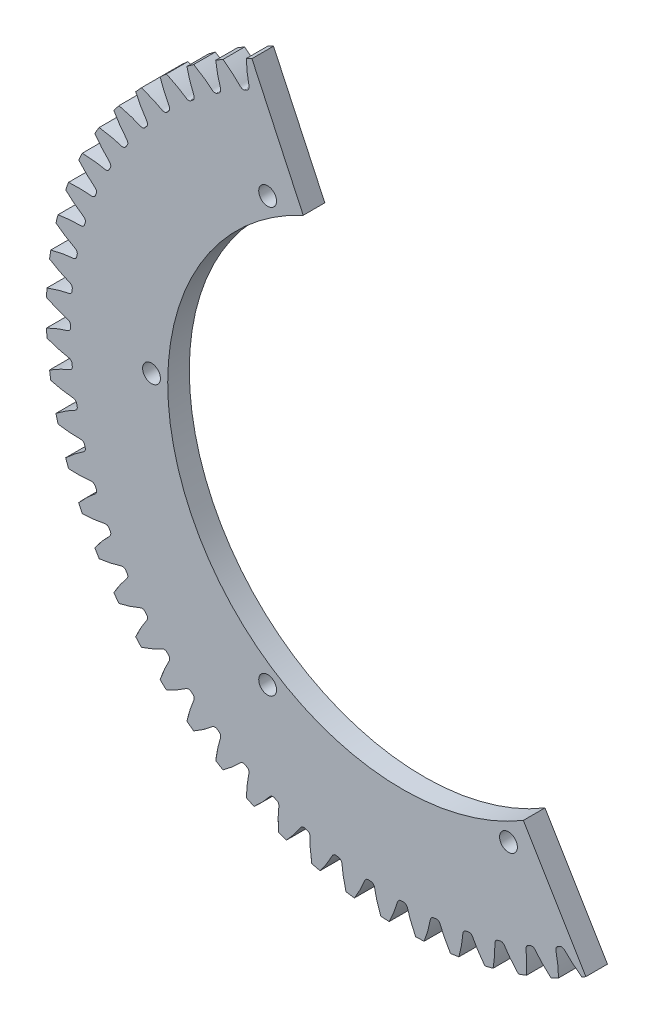
from build123d import *

# Parameters (mm, degrees)
SKETCH_347_W               = 4
SKETCH_347_H               = 65.999999009
CUT_EXTRUDE_657_DEPTH      = 10
PATTERN_CIRCULAR_711_COUNT = 64
SKETCH_746_W               = 20
SKETCH_746_H               = 5
CUT_EXTRUDE_START          = -10
SKETCH_1_R                 = 1.65
CUT_EXTRUDE_1_DEPTH        = 10
CUT_EXTRUDE_START_2        = -8
CUT_EXTRUDE_2_DEPTH        = 8


with BuildPart() as part:
    # Sketch 347 → Revolve 416 (revolve)
    with BuildSketch(Plane(origin=(0, 0, 0), x_dir=(0, 0, -1), z_dir=(1, 0, 0))):
        with Locations((0, 32.999999505)):
            Rectangle(SKETCH_347_W, SKETCH_347_H)
    revolve(axis=Axis((0, 0, 0), (0, 0, -1)))

    # Sketch 461 → Cut-Extrude 657 (cut, symmetric)
    with BuildSketch(Plane.XY):
        with BuildLine():
            ThreePointArc((66.052728022, 2.499397861), (66.099999007, 0), (66.052728022, -2.499397861))
            add(Edge.make_bspline(
                [(66.052728022, -2.499397861), (66.010347767, -2.478097682), (65.946877607, -2.446403725), (65.862330358, -2.404598611), (65.79938941, -2.373681), (65.736735868, -2.343107198), (65.674371094, -2.312875493), (65.612296444, -2.282984169), (65.550513268, -2.253431505), (65.489022907, -2.224215775), (65.427826696, -2.195335251), (65.366925964, -2.166788196), (65.30632203, -2.138572872), (65.24601621, -2.110687535), (65.18600981, -2.083130435), (65.126304128, -2.055899819), (65.066900459, -2.028993931), (65.007800088, -2.002411007), (64.949004292, -1.976149281), (64.890514342, -1.950206981), (64.832331504, -1.924582333), (64.774457033, -1.899273555), (64.716892179, -1.874278864), (64.659638184, -1.84959647), (64.602696283, -1.825224581), (64.546067705, -1.801161399), (64.48975367, -1.777405122), (64.433755392, -1.753953944), (64.378074075, -1.730806056), (64.32271092, -1.707959641), (64.267667117, -1.685412883), (64.212943851, -1.663163957), (64.158542298, -1.641211038), (64.104463628, -1.619552294), (64.050709003, -1.598185889), (63.997279578, -1.577109986), (63.9441765, -1.556322739), (63.891400908, -1.535822304), (63.838953935, -1.515606827), (63.786836707, -1.495674454), (63.73505034, -1.476023327), (63.683595945, -1.456651581), (63.632474625, -1.43755735), (63.581687475, -1.418738764), (63.531235582, -1.400193948), (63.481120026, -1.381921024), (63.431341881, -1.363918109), (63.381902211, -1.346183319), (63.332802074, -1.328714762), (63.28404252, -1.311510547), (63.235624591, -1.294568776), (63.187549322, -1.277887549), (63.139817741, -1.261464962), (63.092430866, -1.245299107), (63.045389711, -1.229388073), (62.99869528, -1.213729945), (62.952348568, -1.198322805), (62.906350566, -1.183164731), (62.860702255, -1.168253798), (62.815404608, -1.153588078), (62.770458593, -1.139165638), (62.725865166, -1.124984543), (62.681625279, -1.111042854), (62.637739875, -1.09733863), (62.594209889, -1.083869926), (62.551036249, -1.070634791), (62.508219873, -1.057631278), (62.465761679, -1.044857421), (62.423662549, -1.032311297), (62.38192346, -1.019990817), (62.340545006, -1.007894487), (62.299529154, -0.996018608), (62.258872779, -0.984367582), (62.180649296, -0.962129409), (62.101810433, -0.940631475), (62.024538042, -0.912404547), (61.983794451, -0.895986993), (61.942672111, -0.877551149), (61.900813329, -0.856593734), (61.857831458, -0.832391826), (61.813334944, -0.803962685), (61.767003704, -0.769967036), (61.718741639, -0.728625092), (61.668955069, -0.677683834), (61.619005679, -0.614565171), (61.571716432, -0.53689732), (61.531861378, -0.443646541), (61.505673668, -0.339741257), (61.495560192, -0.189857501), (61.503034321, 0), (61.495560192, 0.189857501), (61.505673668, 0.339741257), (61.531861378, 0.443646541), (61.571716432, 0.53689732), (61.619005679, 0.614565171), (61.668955069, 0.677683834), (61.718741639, 0.728625092), (61.767003704, 0.769967036), (61.813334944, 0.803962685), (61.857831458, 0.832391826), (61.900813329, 0.856593734), (61.942672111, 0.877551149), (61.983794451, 0.895986993), (62.024538042, 0.912404547), (62.101810433, 0.940631475), (62.180649296, 0.962129409), (62.258872779, 0.984367582), (62.299529154, 0.996018608), (62.340545006, 1.007894487), (62.38192346, 1.019990817), (62.423662549, 1.032311297), (62.465761679, 1.044857421), (62.508219873, 1.057631278), (62.551036249, 1.070634791), (62.594209889, 1.083869926), (62.637739875, 1.09733863), (62.681625279, 1.111042854), (62.725865166, 1.124984543), (62.770458593, 1.139165638), (62.815404608, 1.153588078), (62.860702255, 1.168253798), (62.906350566, 1.183164731), (62.952348568, 1.198322805), (62.99869528, 1.213729945), (63.045389711, 1.229388073), (63.092430866, 1.245299107), (63.139817741, 1.261464962), (63.187549322, 1.277887549), (63.235624591, 1.294568776), (63.28404252, 1.311510547), (63.332802074, 1.328714762), (63.381902211, 1.346183319), (63.431341881, 1.363918109), (63.481120026, 1.381921024), (63.531235582, 1.400193948), (63.581687475, 1.418738764), (63.632474625, 1.43755735), (63.683595945, 1.456651581), (63.73505034, 1.476023327), (63.786836707, 1.495674454), (63.838953935, 1.515606827), (63.891400908, 1.535822304), (63.9441765, 1.556322739), (63.997279578, 1.577109986), (64.050709003, 1.598185889), (64.104463628, 1.619552294), (64.158542298, 1.641211038), (64.212943851, 1.663163957), (64.267667117, 1.685412883), (64.32271092, 1.707959641), (64.378074075, 1.730806056), (64.433755392, 1.753953944), (64.48975367, 1.777405122), (64.546067705, 1.801161399), (64.602696283, 1.825224581), (64.659638184, 1.84959647), (64.716892179, 1.874278864), (64.774457033, 1.899273555), (64.832331504, 1.924582333), (64.890514342, 1.950206981), (64.949004292, 1.976149281), (65.007800088, 2.002411007), (65.066900459, 2.028993931), (65.126304128, 2.055899819), (65.18600981, 2.083130435), (65.24601621, 2.110687535), (65.30632203, 2.138572872), (65.366925964, 2.166788196), (65.427826696, 2.195335251), (65.489022907, 2.224215775), (65.550513268, 2.253431505), (65.612296444, 2.282984169), (65.674371094, 2.312875493), (65.736735868, 2.343107198), (65.79938941, 2.373681), (65.862330358, 2.404598611), (65.946877607, 2.446403725), (66.010347767, 2.478097682), (66.052728022, 2.499397861)],
                knots=[0, 0, 0, 0, 0.012972831, 0.019403273, 0.025796399, 0.032152209, 0.038470703, 0.044751881, 0.050995743, 0.057202289, 0.063371519, 0.069503434, 0.075598032, 0.081655314, 0.087675281, 0.093657931, 0.099603266, 0.105511285, 0.111381987, 0.117215374, 0.123011445, 0.1287702, 0.134491639, 0.140175762, 0.145822569, 0.15143206, 0.157004236, 0.162539095, 0.168036638, 0.173496866, 0.178919777, 0.184305373, 0.189653652, 0.194964616, 0.200238264, 0.205474596, 0.210673612, 0.215835312, 0.220959696, 0.226046764, 0.231096516, 0.236108952, 0.241084072, 0.246021877, 0.250922365, 0.255785537, 0.260611394, 0.265399935, 0.270151159, 0.274865068, 0.279541661, 0.284180938, 0.288782898, 0.293347543, 0.297874872, 0.302364886, 0.306817583, 0.311232964, 0.315611029, 0.319951779, 0.324255212, 0.328521329, 0.332750131, 0.336941617, 0.341095786, 0.34521264, 0.349292178, 0.3533344, 0.357339306, 0.361306896, 0.36523717, 0.369130128, 0.37298577, 0.376804096, 0.391374884, 0.395308241, 0.399297799, 0.403387016, 0.407630456, 0.41209678, 0.416872193, 0.422063789, 0.427801309, 0.434233923, 0.441515649, 0.449770165, 0.459028875, 0.4691555, 0.478908978, 0.5, 0.521091022, 0.5308445, 0.540971125, 0.550229835, 0.558484351, 0.565766077, 0.572198691, 0.577936211, 0.583127807, 0.58790322, 0.592369544, 0.596612984, 0.600702201, 0.604691759, 0.608625116, 0.623195904, 0.62701423, 0.630869872, 0.63476283, 0.638693104, 0.642660694, 0.6466656, 0.650707822, 0.65478736, 0.658904214, 0.663058383, 0.667249869, 0.671478671, 0.675744788, 0.680048221, 0.684388971, 0.688767036, 0.693182417, 0.697635114, 0.702125128, 0.706652457, 0.711217102, 0.715819062, 0.720458339, 0.725134932, 0.729848841, 0.734600065, 0.739388606, 0.744214463, 0.749077635, 0.753978123, 0.758915928, 0.763891048, 0.768903484, 0.773953236, 0.779040304, 0.784164688, 0.789326388, 0.794525404, 0.799761736, 0.805035384, 0.810346348, 0.815694627, 0.821080223, 0.826503134, 0.831963362, 0.837460905, 0.842995764, 0.84856794, 0.854177431, 0.859824238, 0.865508361, 0.8712298, 0.876988555, 0.882784626, 0.888618013, 0.894488715, 0.900396734, 0.906342069, 0.912324719, 0.918344686, 0.924401968, 0.930496566, 0.936628481, 0.942797711, 0.949004257, 0.955248119, 0.961529297, 0.967847791, 0.974203601, 0.980596727, 0.987027169, 1, 1, 1, 1], degree=3))
        make_face()
    cut_extrude_657 = extrude(amount=CUT_EXTRUDE_657_DEPTH, both=True, mode=Mode.SUBTRACT)

    # Pattern Circular 711: Cut-Extrude 657 ×64 about axis
    pattern_circular_711_axis = Axis((0, 0, 55), (0, 0, -1))
    for i in range(1, PATTERN_CIRCULAR_711_COUNT):
        add(cut_extrude_657.rotate(pattern_circular_711_axis, i * 360 / PATTERN_CIRCULAR_711_COUNT), mode=Mode.SUBTRACT)

    # Sketch 746 → Cut-Revolve 786 (revolve, cut)
    with BuildSketch(Plane(origin=(0, 0, 0), x_dir=(0, 0, -1), z_dir=(1, 0, 0))):
        with Locations((0, 2.5)):
            Rectangle(SKETCH_746_W, SKETCH_746_H)
    revolve(axis=Axis((0, 0, 0), (0, 0, -1)), mode=Mode.SUBTRACT)

    # 草图1 → 切除-拉伸1 (cut)
    with BuildSketch(Plane.XY.offset(2).offset(CUT_EXTRUDE_START)):
        with Locations((-24.984431788, 39.21770223)):
            Circle(SKETCH_1_R)
        with Locations((-46.5, 0)):
            Circle(SKETCH_1_R)
        with Locations((19.651749171, 42.143312097)):
            Circle(SKETCH_1_R)
        with Locations((19.651749171, -42.143312097)):
            Circle(SKETCH_1_R)
        with Locations((-24.984431788, -39.21770223)):
            Circle(SKETCH_1_R)
        with BuildLine():
            Line((22.404156259, 37.286777581), (33.992512434, 56.573040997))
            ThreePointArc((33.992512434, 56.573040997), (65.999999009, 0), (33.992512434, -56.573040997))
            Line((33.992512434, -56.573040997), (22.404156259, -37.286777581))
            ThreePointArc((22.404156259, -37.286777581), (-43.5, 0), (22.404156259, 37.286777581))
        make_face()
    extrude(amount=CUT_EXTRUDE_1_DEPTH, mode=Mode.SUBTRACT)

    # 草图2 → 切除-拉伸2 (cut)
    with BuildSketch(Plane.XY.offset(2).offset(CUT_EXTRUDE_START_2)):
        with BuildLine():
            Line((0, 0), (33.992512434, 56.573040997))
            ThreePointArc((33.992512434, 56.573040997), (3.45417306, 65.909548304), (-27.892804856, 59.816313046))
            Line((-27.892804856, 59.816313046), (0, 0))
        make_face()
    extrude(amount=CUT_EXTRUDE_2_DEPTH, mode=Mode.SUBTRACT)


solid = part.part
